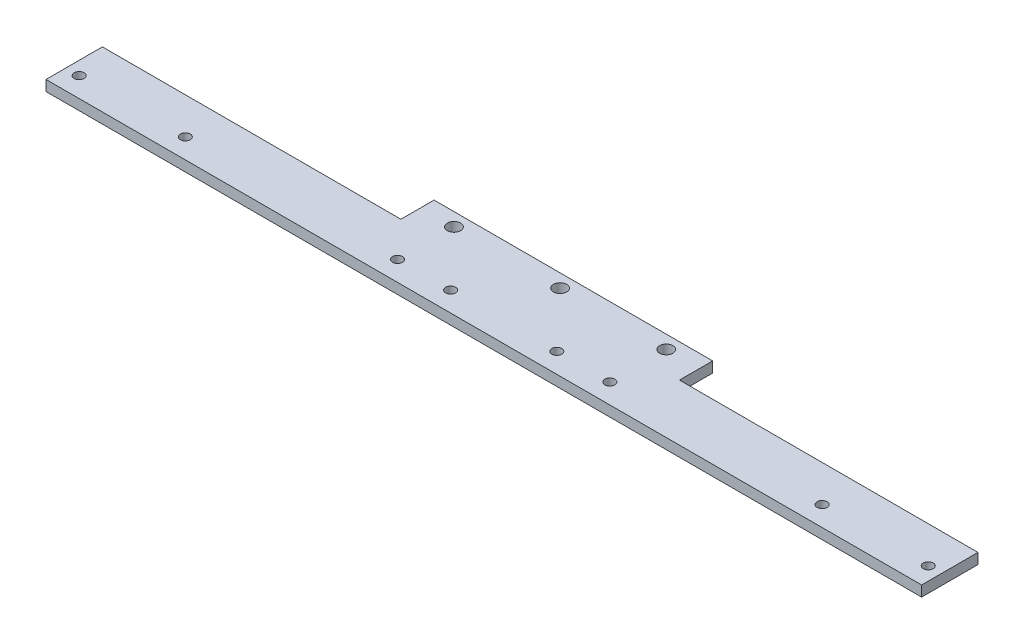
from build123d import *

# Parameters (mm, degrees)
SKETCH1_R           = 2
SKETCH1_R_2         = 1.5
BOSS_EXTRUDE1_DEPTH = 3.175
SKETCH2_R           = 1.5
CUT_EXTRUDE1_DEPTH  = 10
SKETCH3_W           = 90
SKETCH3_H           = 10
CUT_EXTRUDE2_DEPTH  = 10


with BuildPart() as part:
    # Sketch1 → Boss-Extrude1 (new body)
    with BuildSketch(Plane(origin=(0, 0, 0), x_dir=(1, 0, 0), z_dir=(0, 1, 0))):
        Polygon((0, 25.535634143), (0, -1.464365857), (264, -1.464365857), (264, 4.535634143), (264, 25.535634143), align=None)
        with Locations((132, 21.535634143)):
            Circle(SKETCH1_R, mode=Mode.SUBTRACT)
        with Locations((100, 21.535634143)):
            Circle(SKETCH1_R, mode=Mode.SUBTRACT)
        with Locations((68, 21.535634143)):
            Circle(SKETCH1_R, mode=Mode.SUBTRACT)
        with Locations((196, 21.535634143)):
            Circle(SKETCH1_R, mode=Mode.SUBTRACT)
        with Locations((164, 21.535634143)):
            Circle(SKETCH1_R, mode=Mode.SUBTRACT)
        with Locations((260, 4.535634143)):
            Circle(SKETCH1_R_2, mode=Mode.SUBTRACT)
        with Locations((36, 4.535634143)):
            Circle(SKETCH1_R_2, mode=Mode.SUBTRACT)
        with Locations((228, 4.535634143)):
            Circle(SKETCH1_R_2, mode=Mode.SUBTRACT)
        with Locations((4, 4.535634143)):
            Circle(SKETCH1_R_2, mode=Mode.SUBTRACT)
    extrude(amount=BOSS_EXTRUDE1_DEPTH)

    # Sketch2 → Cut-Extrude1 (cut)
    with BuildSketch(Plane(origin=(0, 3.175, 0), x_dir=(1, 0, 0), z_dir=(0, 1, 0))):
        with Locations((116, 4.535634143)):
            Circle(SKETCH2_R)
        with Locations((148, 4.535634143)):
            Circle(SKETCH2_R)
        with Locations((100, 4.535634143)):
            Circle(SKETCH2_R)
        with Locations((164, 4.535634143)):
            Circle(SKETCH2_R)
    extrude(amount=-CUT_EXTRUDE1_DEPTH, mode=Mode.SUBTRACT)

    # Sketch3 → Cut-Extrude2 (cut)
    with BuildSketch(Plane(origin=(0, 3.175, 0), x_dir=(1, 0, 0), z_dir=(0, 1, 0))):
        with Locations((45, 20.535634143)):
            Rectangle(SKETCH3_W, SKETCH3_H)
        with Locations((219, 20.535634143)):
            Rectangle(SKETCH3_W, SKETCH3_H)
    extrude(amount=-CUT_EXTRUDE2_DEPTH, mode=Mode.SUBTRACT)


solid = part.part
